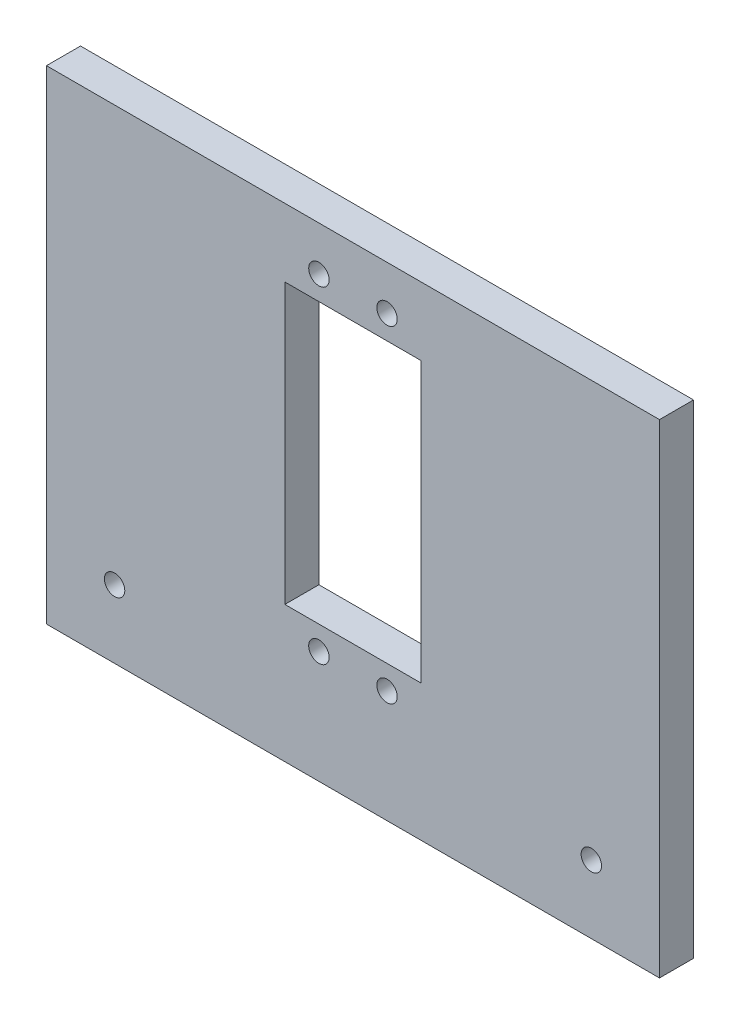
from build123d import *

# Parameters (mm, degrees)
ESQUISSE1_W        = 90
ESQUISSE1_H        = 71
ESQUISSE1_R        = 1.5
ESQUISSE1_W_2      = 20
ESQUISSE1_H_2      = 41
BOSS_EXTRU_1_DEPTH = 5


with BuildPart() as part:
    # Esquisse1 → Boss.-Extru.1 (new body)
    with BuildSketch(Plane.XY):
        with Locations((45, 35.5)):
            Rectangle(ESQUISSE1_W, ESQUISSE1_H)
        with Locations((40, 16.5)):
            Circle(ESQUISSE1_R, mode=Mode.SUBTRACT)
        with Locations((50, 16.5)):
            Circle(ESQUISSE1_R, mode=Mode.SUBTRACT)
        with Locations((50, 64.5)):
            Circle(ESQUISSE1_R, mode=Mode.SUBTRACT)
        with Locations((40, 64.5)):
            Circle(ESQUISSE1_R, mode=Mode.SUBTRACT)
        with Locations((10, 10)):
            Circle(ESQUISSE1_R, mode=Mode.SUBTRACT)
        with Locations((80, 10)):
            Circle(ESQUISSE1_R, mode=Mode.SUBTRACT)
        with Locations((45, 40.5)):
            Rectangle(ESQUISSE1_W_2, ESQUISSE1_H_2, mode=Mode.SUBTRACT)
    extrude(amount=BOSS_EXTRU_1_DEPTH)


solid = part.part
